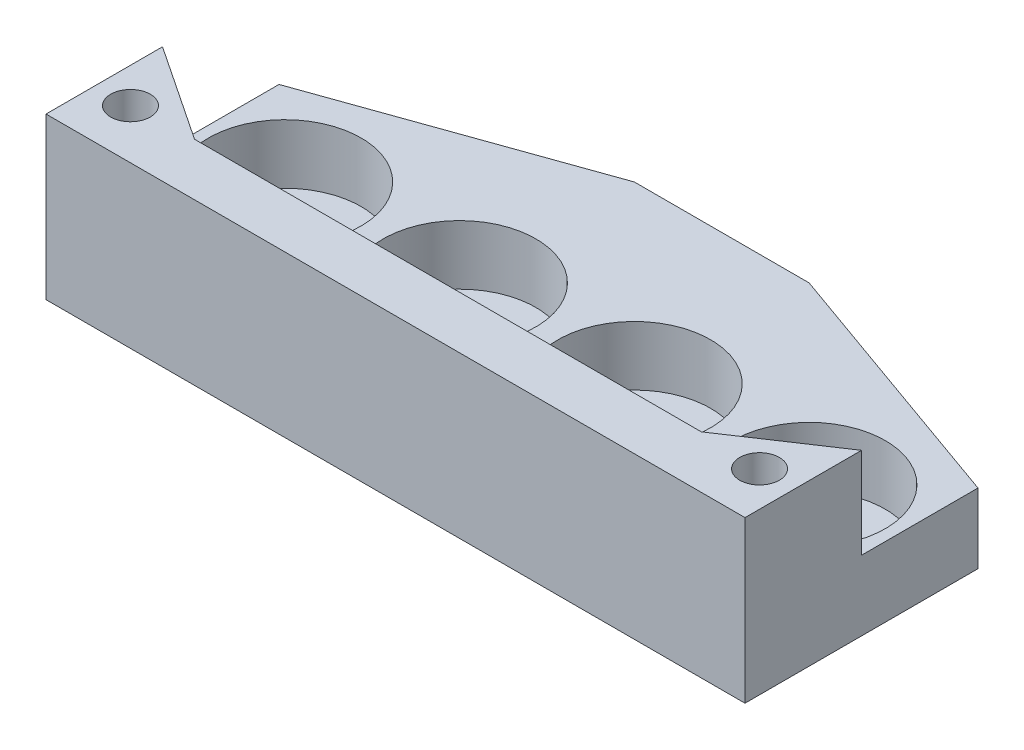
from build123d import *

# Parameters (mm, degrees)
SKETCH2_R           = 2.15
BOSS_EXTRUDE1_DEPTH = 6
BOSS_EXTRUDE2_DEPTH = 7.8
SKETCH4_R           = 1.7
CUT_EXTRUDE1_DEPTH  = 68.634606527
SKETCH5_R           = 6.55
CUT_EXTRUDE2_DEPTH  = 5.1


with BuildPart() as part:
    # Sketch2 → Boss-Extrude1 (new body)
    with BuildSketch(Plane(origin=(0, 0, 0), x_dir=(1, 0, 0), z_dir=(0, 1, 0))):
        Polygon((0, 0), (0, 20), (22.5, 28), (37.5, 28), (60, 20), (60, 0), align=None)
        with Locations((7.5, 13)):
            Circle(SKETCH2_R, mode=Mode.SUBTRACT)
        with Locations((22.5, 13)):
            Circle(SKETCH2_R, mode=Mode.SUBTRACT)
        with Locations((37.5, 13)):
            Circle(SKETCH2_R, mode=Mode.SUBTRACT)
        with Locations((52.5, 13)):
            Circle(SKETCH2_R, mode=Mode.SUBTRACT)
    extrude(amount=BOSS_EXTRUDE1_DEPTH)

    # Sketch3 → Boss-Extrude2 (add)
    with BuildSketch(Plane(origin=(0, 6, 0), x_dir=(1, 0, 0), z_dir=(0, 1, 0))):
        Polygon((0, 10), (0, 0), (60, 0), (60, 10), (51.75, 4.5), (8.25, 4.5), align=None)
    extrude(amount=BOSS_EXTRUDE2_DEPTH)

    # Sketch4 → Cut-Extrude1 (cut, through all)
    with BuildSketch(Plane(origin=(0, 13.8, 0), x_dir=(1, 0, 0), z_dir=(0, 1, 0))):
        with Locations((3, 4.25)):
            Circle(SKETCH4_R)
        with Locations((57, 4.25)):
            Circle(SKETCH4_R)
    extrude(amount=-CUT_EXTRUDE1_DEPTH, mode=Mode.SUBTRACT)

    # Sketch5 → Cut-Extrude2 (cut)
    with BuildSketch(Plane(origin=(0, 6, 0), x_dir=(1, 0, 0), z_dir=(0, 1, 0))):
        with Locations((7.5, 13)):
            Circle(SKETCH5_R)
        with Locations((22.5, 13)):
            Circle(SKETCH5_R)
        with Locations((37.5, 13)):
            Circle(SKETCH5_R)
        with Locations((52.5, 13)):
            Circle(SKETCH5_R)
    extrude(amount=-CUT_EXTRUDE2_DEPTH, mode=Mode.SUBTRACT)


solid = part.part
